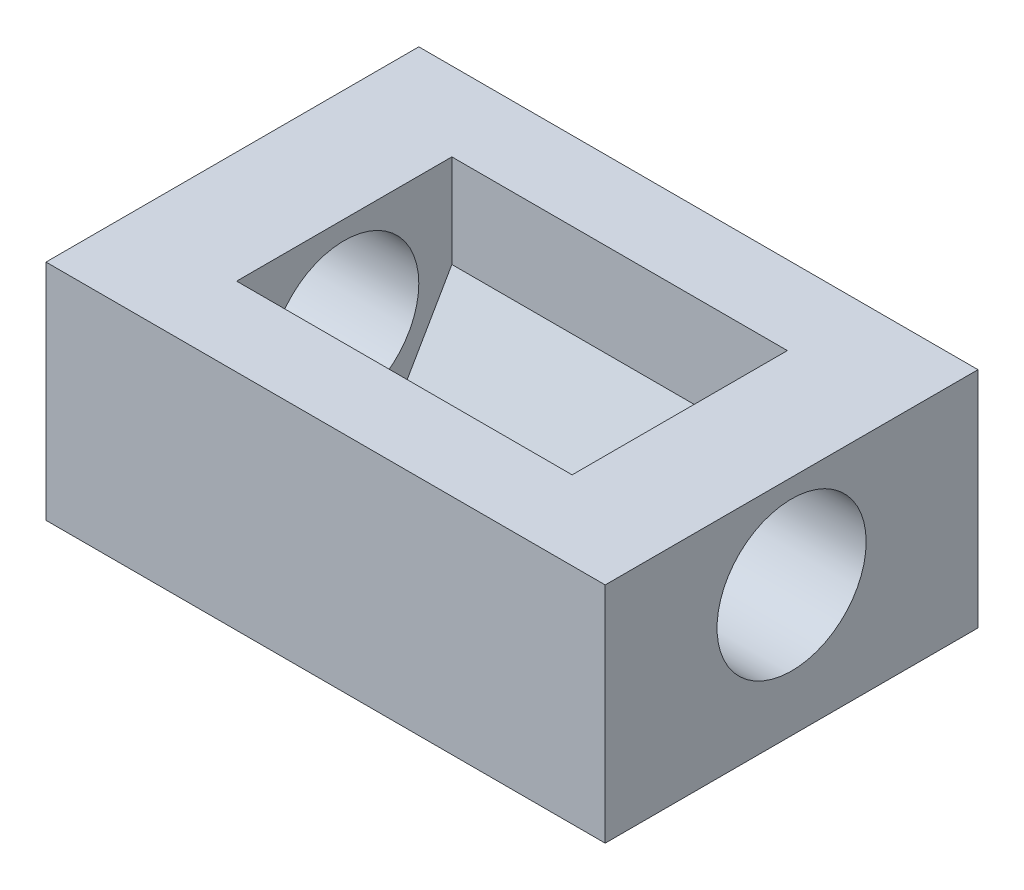
from build123d import *

# Parameters (mm, degrees)
SKETCH1_W               = 30
SKETCH1_H               = 20
BOSS_EXTRUDE1_DEPTH     = 12
CUT_EXTRUDE1_DEPTH      = 9
CUT_EXTRUDE1_DEPTH_BACK = 9
CUT_EXTRUDE2_DEPTH      = 22.656407828
CUT_EXTRUDE2_DEPTH_BACK = 22.656407828
SKETCH3_R               = 4


with BuildPart() as part:
    # Sketch1 → Boss-Extrude1 (new body)
    with BuildSketch(Plane(origin=(0, 0, 0), x_dir=(1, 0, 0), z_dir=(0, 1, 0))):
        Rectangle(SKETCH1_W, SKETCH1_H)
    extrude(amount=BOSS_EXTRUDE1_DEPTH)

    # Sketch2 → Cut-Extrude1 (cut, two sides: drawn at the far end of the back side and taken through both)
    with BuildSketch(Plane(origin=(0, 0, 0), x_dir=(0, 0, -1), z_dir=(1, 0, 0)).offset(-CUT_EXTRUDE1_DEPTH_BACK)):
        Polygon((-2.886751346, 2), (2.886751346, 2), (5.773502692, 7), (5.773502692, 12), (-5.773502692, 12), (-5.773502692, 7), align=None)
    extrude(amount=CUT_EXTRUDE1_DEPTH + CUT_EXTRUDE1_DEPTH_BACK, mode=Mode.SUBTRACT)

    # Sketch3 → Cut-Extrude2 (cut, two sides: drawn at the far end of the back side and taken through both)
    with BuildSketch(Plane(origin=(0, 0, 0), x_dir=(0, 0, -1), z_dir=(1, 0, 0)).offset(-CUT_EXTRUDE2_DEPTH_BACK)):
        with Locations((0, 7)):
            Circle(SKETCH3_R)
    extrude(amount=CUT_EXTRUDE2_DEPTH + CUT_EXTRUDE2_DEPTH_BACK, mode=Mode.SUBTRACT)


solid = part.part
